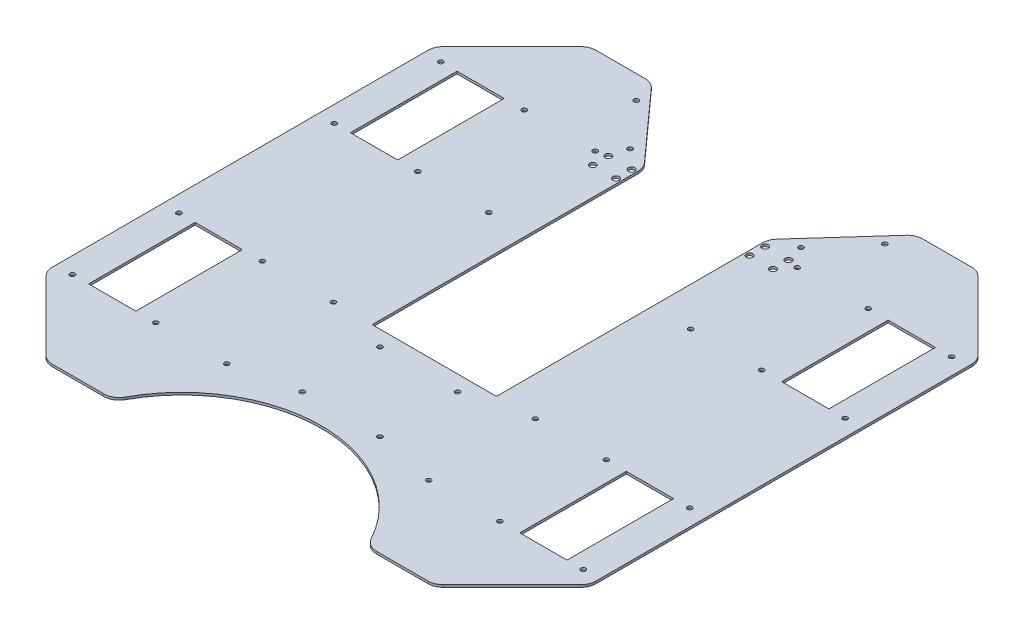
from build123d import *

# Parameters (mm, degrees)
SKETCH_1_R          = 1.55
SKETCH_1_R_2        = 2.05
SKETCH_1_W          = 30.4
SKETCH_1_H          = 68.58
EXTRUDE_1_DEPTH     = 1.5
FILLET_1_R          = 10
FILLET_2_R          = 10
FILLET_3_R          = 10
SKETCH_2_W          = 80
SKETCH_2_H          = 135
CUT_EXTRUDE_1_DEPTH = 10


with BuildPart() as part:
    # 草图1 → 凸台-拉伸1 (new body)
    with BuildSketch(Plane(origin=(0, 0, 0), x_dir=(1, 0, 0), z_dir=(0, 1, 0))):
        with BuildLine():
            Line((-125, 175), (-175, 125))
            Line((-175, 125), (-175, -125))
            Line((-175, -125), (-125, -175))
            Line((-125, -175), (-81.710313025, -175))
            ThreePointArc((-81.710313025, -175), (0, -122.728301649), (81.710313025, -175))
            Line((81.710313025, -175), (125, -175))
            Line((125, -175), (175, -125))
            Line((175, -125), (175, 125))
            Line((175, 125), (125, 175))
            Line((125, 175), (85, 175))
            Line((85, 175), (40, 125))
            Line((40, 125), (40, 85))
            Line((40, 85), (-40, 85))
            Line((-40, 85), (-40, 125))
            Line((-40, 125), (-85, 175))
            Line((-85, 175), (-125, 175))
        make_face()
        with Locations((-55, 131)):
            Circle(SKETCH_1_R, mode=Mode.SUBTRACT)
        with Locations((-80, 160)):
            Circle(SKETCH_1_R, mode=Mode.SUBTRACT)
        with Locations((55, 131)):
            Circle(SKETCH_1_R, mode=Mode.SUBTRACT)
        with Locations((80, 160)):
            Circle(SKETCH_1_R, mode=Mode.SUBTRACT)
        with Locations((-65, 118.58)):
            Circle(SKETCH_1_R, mode=Mode.SUBTRACT)
        with Locations((-65, 50)):
            Circle(SKETCH_1_R, mode=Mode.SUBTRACT)
        with Locations((-110.72, 50)):
            Circle(SKETCH_1_R, mode=Mode.SUBTRACT)
        with Locations((-110.72, 118.58)):
            Circle(SKETCH_1_R, mode=Mode.SUBTRACT)
        with Locations((-164.434, 118.58)):
            Circle(SKETCH_1_R, mode=Mode.SUBTRACT)
        with Locations((-164.434, 50)):
            Circle(SKETCH_1_R, mode=Mode.SUBTRACT)
        with Locations((-65, -118.58)):
            Circle(SKETCH_1_R, mode=Mode.SUBTRACT)
        with Locations((-65, -50)):
            Circle(SKETCH_1_R, mode=Mode.SUBTRACT)
        with Locations((-110.72, -50)):
            Circle(SKETCH_1_R, mode=Mode.SUBTRACT)
        with Locations((-110.72, -118.58)):
            Circle(SKETCH_1_R, mode=Mode.SUBTRACT)
        with Locations((-164.434, -50)):
            Circle(SKETCH_1_R, mode=Mode.SUBTRACT)
        with Locations((-164.434, -118.58)):
            Circle(SKETCH_1_R, mode=Mode.SUBTRACT)
        with Locations((65, 50)):
            Circle(SKETCH_1_R, mode=Mode.SUBTRACT)
        with Locations((110.72, 50)):
            Circle(SKETCH_1_R, mode=Mode.SUBTRACT)
        with Locations((110.72, 118.58)):
            Circle(SKETCH_1_R, mode=Mode.SUBTRACT)
        with Locations((65, 118.58)):
            Circle(SKETCH_1_R, mode=Mode.SUBTRACT)
        with Locations((164.434, 118.58)):
            Circle(SKETCH_1_R, mode=Mode.SUBTRACT)
        with Locations((164.434, 50)):
            Circle(SKETCH_1_R, mode=Mode.SUBTRACT)
        with Locations((164.434, -118.58)):
            Circle(SKETCH_1_R, mode=Mode.SUBTRACT)
        with Locations((164.434, -50)):
            Circle(SKETCH_1_R, mode=Mode.SUBTRACT)
        with Locations((110.72, -50)):
            Circle(SKETCH_1_R, mode=Mode.SUBTRACT)
        with Locations((110.72, -118.58)):
            Circle(SKETCH_1_R, mode=Mode.SUBTRACT)
        with Locations((65, -118.58)):
            Circle(SKETCH_1_R, mode=Mode.SUBTRACT)
        with Locations((65, -50)):
            Circle(SKETCH_1_R, mode=Mode.SUBTRACT)
        with Locations((25, -60)):
            Circle(SKETCH_1_R, mode=Mode.SUBTRACT)
        with Locations((25, -110)):
            Circle(SKETCH_1_R, mode=Mode.SUBTRACT)
        with Locations((-25, -60)):
            Circle(SKETCH_1_R, mode=Mode.SUBTRACT)
        with Locations((-25, -110)):
            Circle(SKETCH_1_R, mode=Mode.SUBTRACT)
        with Locations((-43, 120)):
            Circle(SKETCH_1_R_2, mode=Mode.SUBTRACT)
        with Locations((-43, 110)):
            Circle(SKETCH_1_R_2, mode=Mode.SUBTRACT)
        with Locations((-58, 110)):
            Circle(SKETCH_1_R_2, mode=Mode.SUBTRACT)
        with Locations((-58, 120)):
            Circle(SKETCH_1_R_2, mode=Mode.SUBTRACT)
        with Locations((43, 120)):
            Circle(SKETCH_1_R_2, mode=Mode.SUBTRACT)
        with Locations((58, 120)):
            Circle(SKETCH_1_R_2, mode=Mode.SUBTRACT)
        with Locations((58, 110)):
            Circle(SKETCH_1_R_2, mode=Mode.SUBTRACT)
        with Locations((43, 110)):
            Circle(SKETCH_1_R_2, mode=Mode.SUBTRACT)
        with Locations((-138.794, 84.29)):
            Rectangle(SKETCH_1_W, SKETCH_1_H, mode=Mode.SUBTRACT)
        with Locations((138.794, 84.29)):
            Rectangle(SKETCH_1_W, SKETCH_1_H, mode=Mode.SUBTRACT)
        with Locations((-138.794, -84.29)):
            Rectangle(SKETCH_1_W, SKETCH_1_H, mode=Mode.SUBTRACT)
        with Locations((138.794, -84.29)):
            Rectangle(SKETCH_1_W, SKETCH_1_H, mode=Mode.SUBTRACT)
    extrude(amount=EXTRUDE_1_DEPTH)

    # 圆角1
    fillet_1_edges = [part.edges().sort_by_distance(p)[0] for p in [
        (-40, 0.75, -125),
    ]]
    fillet(fillet_1_edges, radius=FILLET_1_R)

    # 圆角2
    fillet_2_edges = [part.edges().sort_by_distance(p)[0] for p in [
        (40, 0.75, -125),
    ]]
    fillet(fillet_2_edges, radius=FILLET_2_R)

    # 圆角3
    fillet_3_edges = [part.edges().sort_by_distance(p)[0] for p in [
        (-85, 0.75, -175),
        (85, 0.75, -175),
        (125, 0.75, -175),
        (175, 0.75, -125),
        (175, 0.75, 125),
        (125, 0.75, 175),
        (81.710313025, 0.75, 175),
        (-81.710313025, 0.75, 175),
        (-125, 0.75, 175),
        (-175, 0.75, 125),
        (-175, 0.75, -125),
        (-125, 0.75, -175),
    ]]
    fillet(fillet_3_edges, radius=FILLET_3_R)

    # 草图2 → 切除-拉伸1 (cut)
    with BuildSketch(Plane(origin=(0, 1.5, 0), x_dir=(1, 0, 0), z_dir=(0, 1, 0))):
        with Locations((0, 17.5)):
            Rectangle(SKETCH_2_W, SKETCH_2_H)
    extrude(amount=-CUT_EXTRUDE_1_DEPTH, mode=Mode.SUBTRACT)


solid = part.part
